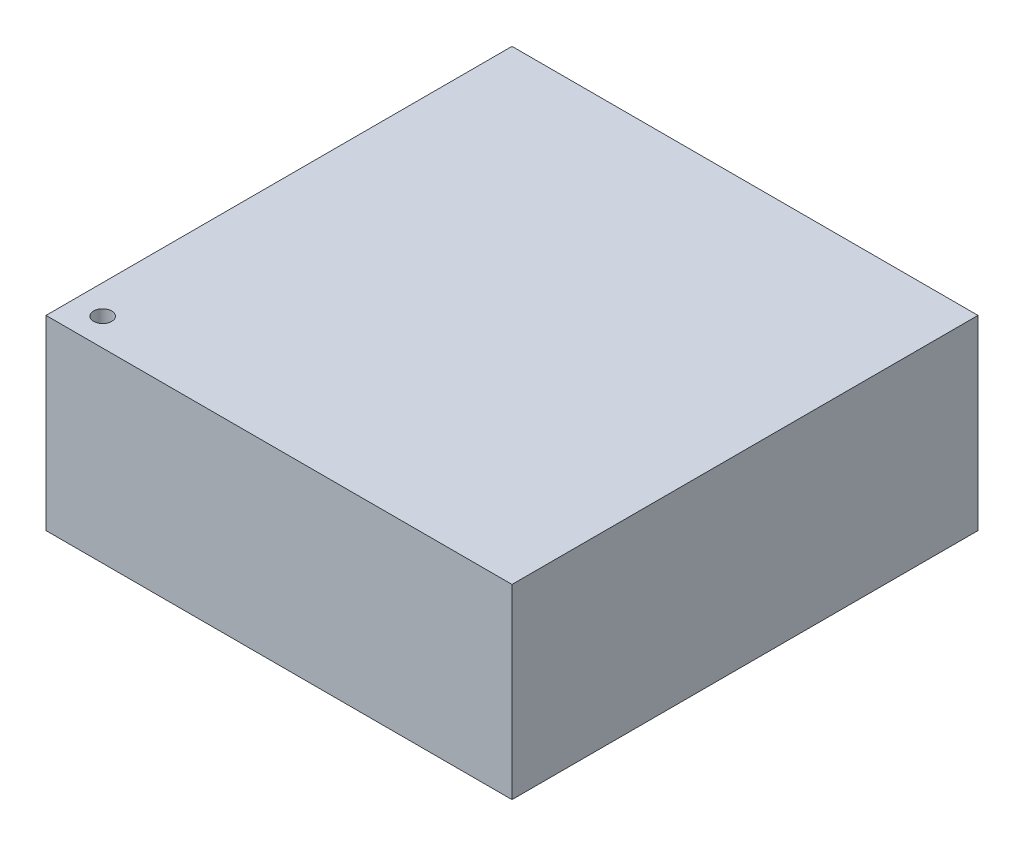
from build123d import *

# Parameters (mm, degrees)
SKETCH1_W           = 130
SKETCH1_H           = 130
BOSS_EXTRUDE1_DEPTH = 52
SKETCH2_R           = 2.527235636
CUT_EXTRUDE1_DEPTH  = 10


with BuildPart() as part:
    # Sketch1 → Boss-Extrude1 (new body)
    with BuildSketch(Plane(origin=(0, 0, 0), x_dir=(1, 0, 0), z_dir=(0, 1, 0))):
        Rectangle(SKETCH1_W, SKETCH1_H)
    extrude(amount=BOSS_EXTRUDE1_DEPTH)

    # Sketch2 → Cut-Extrude1 (cut)
    with BuildSketch(Plane(origin=(0, 52, 0), x_dir=(1, 0, 0), z_dir=(0, 1, 0))):
        with Locations((-56.907861824, -57.290089516)):
            Circle(SKETCH2_R)
    extrude(amount=-CUT_EXTRUDE1_DEPTH, mode=Mode.SUBTRACT)


solid = part.part
